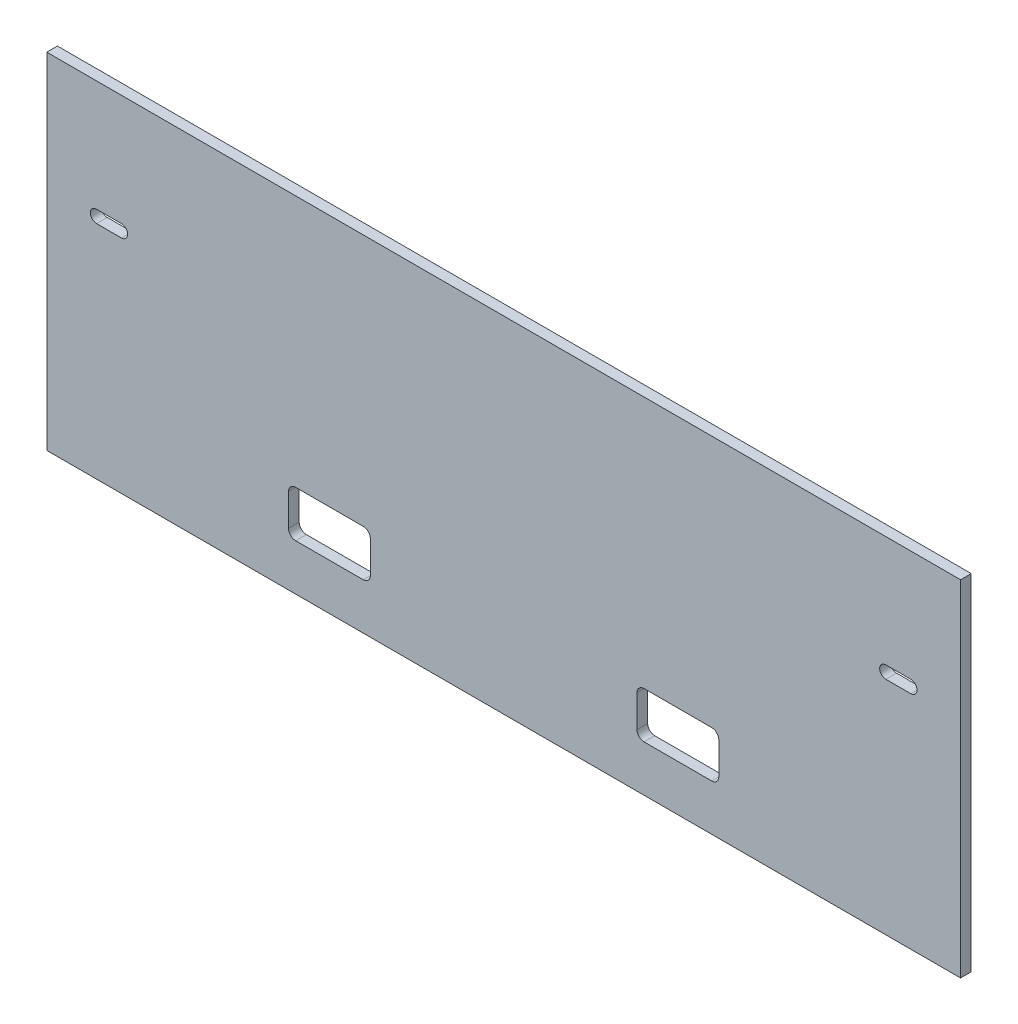
from build123d import *

# Parameters (mm, degrees)
ESQUISSE1_W             = 257
ESQUISSE1_H             = 97
BOSS_EXTRU_1_DEPTH      = 3
ENL_V_MAT_EXTRU_1_REACH = 139.381
ESQUISSE2_W             = 23
ESQUISSE2_H             = 13
CONG_1_R                = 2


with BuildPart() as part:
    # Esquisse1 → Boss.-Extru.1 (new body)
    with BuildSketch(Plane.XY):
        Rectangle(ESQUISSE1_W, ESQUISSE1_H)
        with BuildLine():
            Line((-114.5, 17.25), (-107.5, 17.25))
            ThreePointArc((-107.5, 17.25), (-105.75, 15.5), (-107.5, 13.75))
            Line((-107.5, 13.75), (-114.5, 13.75))
            ThreePointArc((-114.5, 13.75), (-116.25, 15.5), (-114.5, 17.25))
        make_face(mode=Mode.SUBTRACT)
        with BuildLine():
            Line((107.5, 17.25), (114.5, 17.25))
            ThreePointArc((114.5, 17.25), (116.25, 15.5), (114.5, 13.75))
            Line((114.5, 13.75), (107.5, 13.75))
            ThreePointArc((107.5, 13.75), (105.75, 15.5), (107.5, 17.25))
        make_face(mode=Mode.SUBTRACT)
    extrude(amount=BOSS_EXTRU_1_DEPTH)

    # Esquisse2 → Enlèv. mat.-Extru.1 (cut, up to next)
    with BuildSketch(Plane.XY.offset(3), mode=Mode.PRIVATE) as enl_v_mat_extru_1_sk1:
        with Locations((-49, -29)):
            Rectangle(ESQUISSE2_W, ESQUISSE2_H)
    enl_v_mat_extru_1_tool1 = extrude(enl_v_mat_extru_1_sk1.sketch, amount=-ENL_V_MAT_EXTRU_1_REACH, mode=Mode.PRIVATE) & part.part
    # Esquisse2 → Enlèv. mat.-Extru.1 (cut, up to next)
    with BuildSketch(Plane.XY.offset(3), mode=Mode.PRIVATE) as enl_v_mat_extru_1_sk2:
        with Locations((49, -29)):
            Rectangle(ESQUISSE2_W, ESQUISSE2_H)
    enl_v_mat_extru_1_tool2 = extrude(enl_v_mat_extru_1_sk2.sketch, amount=-ENL_V_MAT_EXTRU_1_REACH, mode=Mode.PRIVATE) & part.part
    add(enl_v_mat_extru_1_tool1.solids().sort_by_distance((-49, -29, 3))[0], mode=Mode.SUBTRACT)
    add(enl_v_mat_extru_1_tool2.solids().sort_by_distance((49, -29, 3))[0], mode=Mode.SUBTRACT)

    # Congé1
    cong_1_edges = [part.edges().sort_by_distance(p)[0] for p in [
        (37.5, -35.5, 1.5),
        (60.5, -35.5, 1.5),
        (60.5, -22.5, 1.5),
        (37.5, -22.5, 1.5),
        (-60.5, -35.5, 1.5),
        (-37.5, -35.5, 1.5),
        (-37.5, -22.5, 1.5),
        (-60.5, -22.5, 1.5),
    ]]
    fillet(cong_1_edges, radius=CONG_1_R)


solid = part.part
